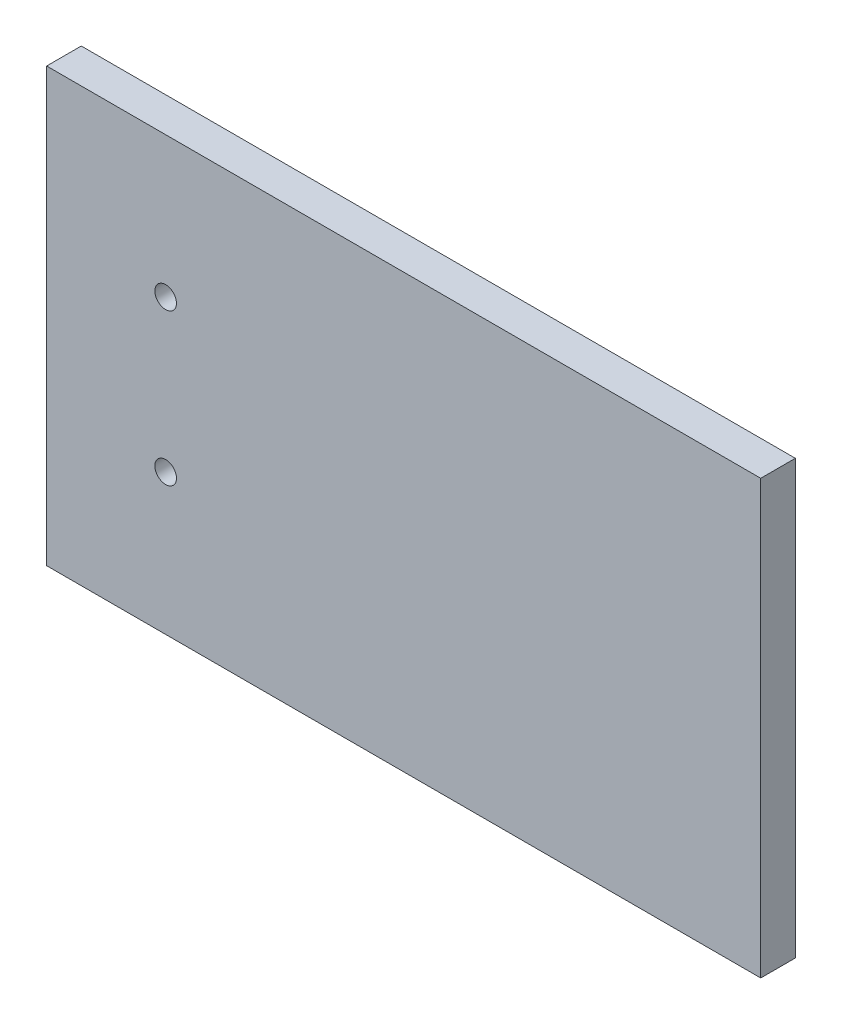
from build123d import *

# Parameters (mm, degrees)
SKETCH11_W                      = 66
SKETCH11_H                      = 40
HOLE_SIDE_THING_DEPTH           = 3.2
SKETCH12_R                      = 1
HOLES_FOR_HOLE_SIDE_THING_DEPTH = 3.2


with BuildPart() as part:
    # Sketch11 → Hole Side Thing (new body)
    with BuildSketch(Plane.XY):
        Rectangle(SKETCH11_W, SKETCH11_H)
    extrude(amount=HOLE_SIDE_THING_DEPTH)

    # Sketch12 → Holes for Hole Side Thing (cut)
    with BuildSketch(Plane.XY.offset(3.2)):
        with Locations((-22, 7)):
            Circle(SKETCH12_R)
        with Locations((-22, -7)):
            Circle(SKETCH12_R)
    extrude(amount=-HOLES_FOR_HOLE_SIDE_THING_DEPTH, mode=Mode.SUBTRACT)


solid = part.part
